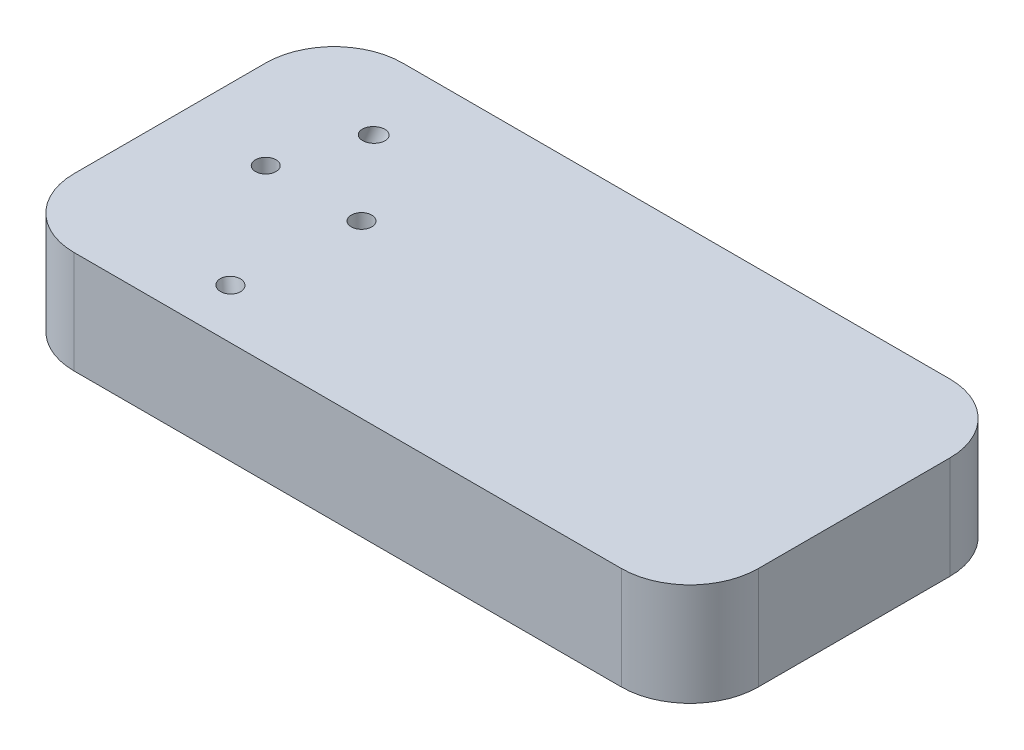
from build123d import *

# Parameters (mm, degrees)
BODY_GLIDER_RIGHT_DEPTH      = 25
BODY_GLIDER_RIGHT_DEPTH_BACK = 23
NUTRIGHTWING_DEPTH           = 34
NUTLEFTWING_DEPTH            = 24
SKETCH19_R                   = 1.5
CUT_EXTRUDE8_DEPTH           = 35
SKETCH20_R                   = 3
CUT_EXTRUDE9_DEPTH           = 5
FILLET4_R                    = 10


with BuildPart() as part:
    # Sketch9 → Body_Glider_Right (new, two sides: drawn at the far end of the back side and taken through both)
    with BuildSketch(Plane.XY.offset(-BODY_GLIDER_RIGHT_DEPTH_BACK)):
        Polygon((100, 0), (0, 0), (0, 15), (9.991154054, 15), (100, 15), align=None)
    extrude(amount=BODY_GLIDER_RIGHT_DEPTH + BODY_GLIDER_RIGHT_DEPTH_BACK)

    # Sketch6 → BallBearingHoleRW (revolve, cut)
    with BuildSketch(Plane(origin=(0, 0, 0), x_dir=(0.8219256175556252, 0, -0.5695948377626013), z_dir=(0.5695948377626013, 0, 0.8219256175556252))):
        Polygon((21.187492771, 12), (19.77795384, 12.513030215), (23.198155273, 21.909956423), (24.607694205, 21.396926208), align=None)
    revolve(axis=Axis((17, 15, -11.781007959), (0.2811151175194144, 0.9396926207859081, -0.19481290804912643)), mode=Mode.SUBTRACT)

    # Sketch8 → BallBearingHoleLW (revolve, cut)
    with BuildSketch(Plane(origin=(0, 0, 0), x_dir=(0.8219256175556252, 0, 0.5695948377626013), z_dir=(-0.5695948377626013, 0, 0.8219256175556252))):
        Polygon((27.161593276, 21.396926208), (28.571132207, 21.909956423), (31.991333641, 12.513030215), (30.58179471, 12), align=None)
    revolve(axis=Axis((25.550503583, 15, 17.706510945), (-0.2811151175194091, 0.9396926207859104, -0.1948129080491227)), mode=Mode.SUBTRACT)

    # Sketch14 → NutRightWing (cut)
    with BuildSketch(Plane(origin=(-0.2295928, 0.767467298, -0.159107918), x_dir=(0.9596698795061062, 0.27585958790626763, -0.05417757957790449), z_dir=(-0.2811151175194091, 0.9396926207859105, -0.19481290804912274))):
        Polygon((27.28966162, -16.977652093), (24.615864959, -18.993624501), (25.024849947, -22.317186538), (28.107631596, -23.624776166), (30.781428257, -21.608803758), (30.372443269, -18.285241722), align=None)
    extrude(amount=-NUTRIGHTWING_DEPTH, mode=Mode.SUBTRACT)

    # Sketch15 → NutLeftWing (cut)
    with BuildSketch(Plane(origin=(5.20705618, 17.405795576, -3.608492371), x_dir=(0.9596698795061045, -0.27585958790627246, 0.05417757957790671), z_dir=(0.28111511751941437, 0.9396926207859082, -0.19481290804912643))):
        Polygon((8.270797964, 7.723767658), (10.539278504, 5.260572705), (13.806708177, 5.993537005), (14.80565731, 9.189696256), (12.53717677, 11.652891209), (9.269747097, 10.919926909), align=None)
    extrude(amount=-NUTLEFTWING_DEPTH, mode=Mode.SUBTRACT)

    # Sketch19 → Cut-Extrude8 (cut)
    with BuildSketch(Plane(origin=(0, 0, 0), x_dir=(1, 0, 0), z_dir=(0, 1, 0))):
        with Locations((13.001901128, 0)):
            Circle(SKETCH19_R)
        with Locations((27.001901128, 0)):
            Circle(SKETCH19_R)
    extrude(amount=CUT_EXTRUDE8_DEPTH, mode=Mode.SUBTRACT)

    # Sketch20 → Cut-Extrude9 (cut)
    with BuildSketch(Plane.XZ):
        with Locations((13.001901128, 0)):
            Circle(SKETCH20_R)
        with Locations((27.001901128, 0)):
            Circle(SKETCH20_R)
    extrude(amount=-CUT_EXTRUDE9_DEPTH, mode=Mode.SUBTRACT)

    # Fillet4
    fillet4_edges = [part.edges().sort_by_distance(p)[0] for p in [
        (100, 7.5, -23),
        (100, 7.5, 25),
        (0, 7.5, -23),
        (0, 7.5, 25),
    ]]
    fillet(fillet4_edges, radius=FILLET4_R)


solid = part.part
